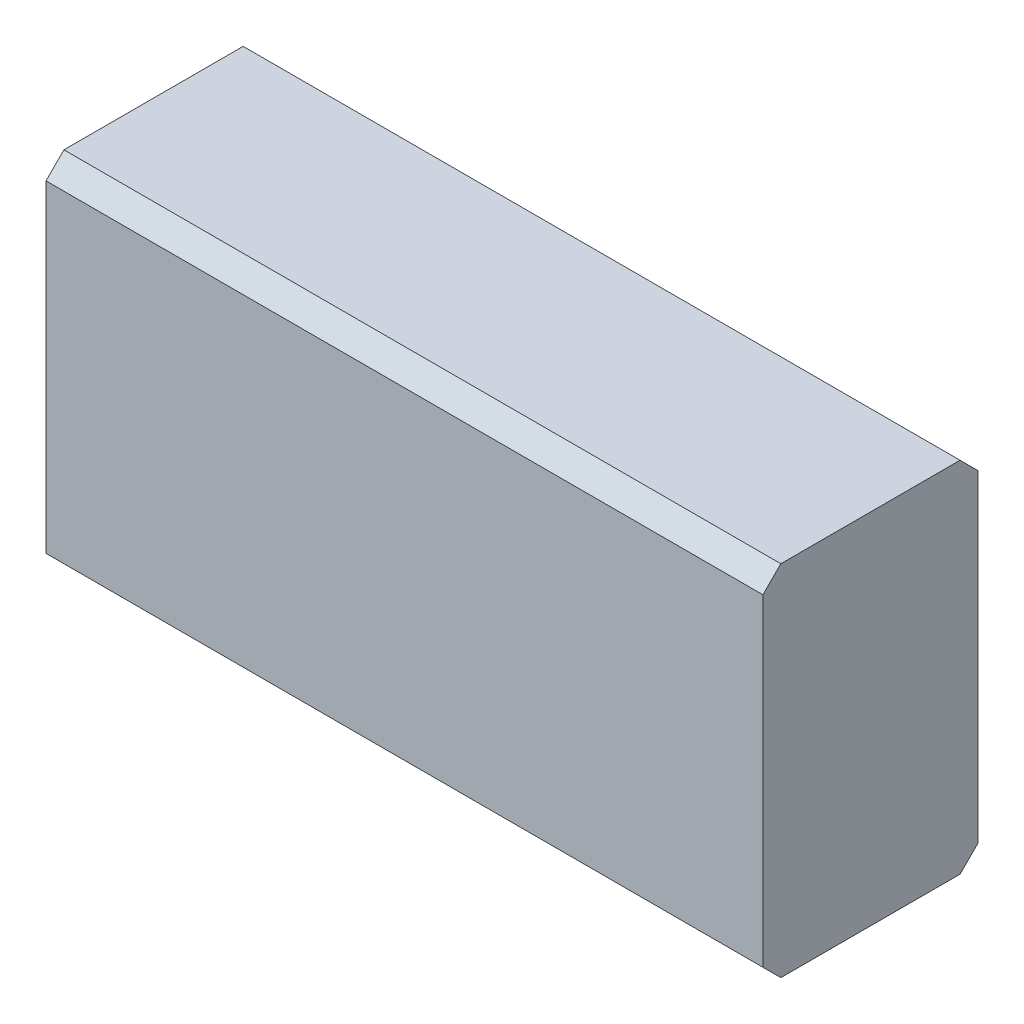
from build123d import *

# Parameters (mm, degrees)
EXTRUDE1_DEPTH = 3
SKETCH2_W      = 10
SKETCH2_H      = 5
EXTRUDE2_DEPTH = 3
EXTRUDE3_DEPTH = 3
CHAMFER1_SIZE  = 0.25


with BuildPart() as part:
    # Sketch1 → Extrude1 (new body)
    with BuildSketch(Plane.XY):
        with BuildLine():
            Line((0, 2.5), (-5, 2.5))
            ThreePointArc((-5, 2.5), (-7.5, 0), (-5, -2.5))
            Line((-5, -2.5), (0, -2.5))
            ThreePointArc((0, -2.5), (2.5, 0), (0, 2.5))
        make_face()
    extrude(amount=EXTRUDE1_DEPTH)

    # Sketch2 → Extrude2 (add)
    with BuildSketch(Plane.XY):
        with Locations((-2.5, 0)):
            Rectangle(SKETCH2_W, SKETCH2_H)
    extrude(amount=EXTRUDE2_DEPTH)

    # Sketch3 → Extrude3 (add)
    with BuildSketch(Plane.XY):
        with BuildLine():
            Line((-5, -2.5), (2.5, -2.5))
            Line((2.5, -2.5), (2.5, 2.5))
            Line((2.5, 2.5), (-5, 2.5))
            ThreePointArc((-5, 2.5), (-7.5, 0), (-5, -2.5))
        make_face()
    extrude(amount=EXTRUDE3_DEPTH)

    # Chamfer1
    chamfer1_edges = [part.edges().sort_by_distance(p)[0] for p in [
        (-2.5, 2.5, 0),
        (-2.5, -2.5, 0),
        (-2.5, 2.5, 3),
        (-2.5, -2.5, 3),
    ]]
    chamfer(chamfer1_edges, length=CHAMFER1_SIZE)


solid = part.part
